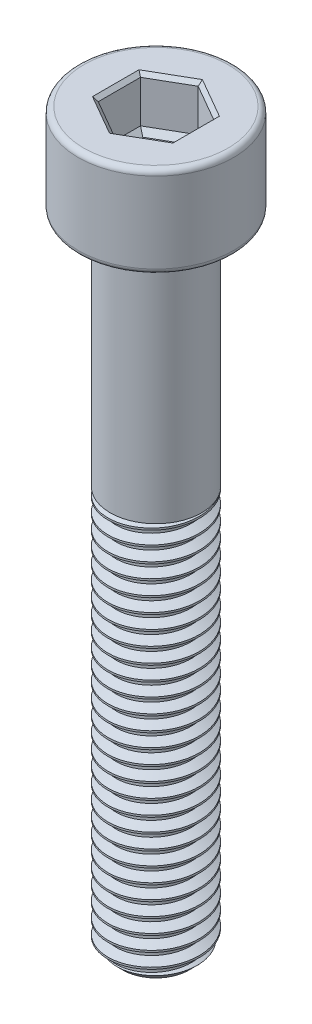
from build123d import *

# Parameters (mm, degrees)
SKETCH1_R           = 2.5
BOSS_EXTRUDE1_DEPTH = 22
THREAD1_PITCH       = 0.8
SKETCH2_R           = 2.5
BOSS_EXTRUDE2_DEPTH = 13
SKETCH3_R           = 4.25
BOSS_EXTRUDE3_DEPTH = 5
FILLET1_R           = 0.3
CUT_EXTRUDE1_DEPTH  = 2.5
CHAMFER1_SIZE       = 0.2
CUT_EXTRUDE2_DEPTH  = 0.3
CUT_EXTRUDE2_DRAFT  = -45


with BuildPart() as part:
    # Sketch1 → Boss-Extrude1 (new body)
    with BuildSketch(Plane(origin=(0, 0, 0), x_dir=(1, 0, 0), z_dir=(0, 1, 0))):
        with Locations(Location((0, 0, 0), (0, 0, 270))):
            Circle(SKETCH1_R)
    extrude(amount=BOSS_EXTRUDE1_DEPTH)

    # Thread1: the profile of Thread Profile1 profile screwed along a right-hand helix of 28.75 turns, 8 arcs to a turn; built about Z, then put on its axis
    thread1_z = Axis((0, 0, 0), (0, 0, 1))
    thread1_corners = [(2.5003, 0, -0.000173205), (2.5003, 0, 0.700173203), (2.0669873, 0, 0.449999999), (2.0669873, 0, 0.249999999)]
    with BuildLine(mode=Mode.PRIVATE) as thread1_profile:
        Line(thread1_corners[0], thread1_corners[1])
        Line(thread1_corners[1], thread1_corners[2])
        Line(thread1_corners[2], thread1_corners[3])
        Line(thread1_corners[3], thread1_corners[0])
    thread1_cap = Face(thread1_profile.wire())
    thread1_turn_angles = [0, 22.5, 45, 67.5, 90, 112.5, 135, 157.5, 180, 202.5, 225, 247.5, 270, 292.5, 315, 337.5, 360]
    thread1_turn_weights = [1, 0.9238795325112867, 1, 0.9238795325112867, 1, 0.9238795325112867, 1, 0.9238795325112867, 1, 0.9238795325112867, 1, 0.9238795325112867, 1, 0.9238795325112867, 1, 0.9238795325112867, 1]
    thread1_turn_rails = [Edge.make_bspline([Vector(p[0], p[1], 0).rotate(thread1_z, thread1_turn_angles[k]) / thread1_turn_weights[k] + Vector(0, 0, p[2] + THREAD1_PITCH * thread1_turn_angles[k] / 360) for k in range(17)], [0, 0, 0, 1, 1, 2, 2, 3, 3, 4, 4, 5, 5, 6, 6, 7, 7, 8, 8, 8], 2, thread1_turn_weights) for p in thread1_corners]
    thread1_turn_sides = [Face.make_surface_from_curves(thread1_turn_rails[p[0]], thread1_turn_rails[p[1]]) for p in [(0, 1), (1, 2), (2, 3), (3, 0)]]
    thread1_last_angles = [10080, 10102.5, 10125, 10147.5, 10170, 10192.5, 10215, 10237.5, 10260, 10282.5, 10305, 10327.5, 10350]
    thread1_last_weights = [1, 0.9238795325112867, 1, 0.9238795325112867, 1, 0.9238795325112867, 1, 0.9238795325112867, 1, 0.9238795325112867, 1, 0.9238795325112867, 1]
    thread1_last_rails = [Edge.make_bspline([Vector(p[0], p[1], 0).rotate(thread1_z, thread1_last_angles[k]) / thread1_last_weights[k] + Vector(0, 0, p[2] + THREAD1_PITCH * thread1_last_angles[k] / 360) for k in range(13)], [0, 0, 0, 1, 1, 2, 2, 3, 3, 4, 4, 5, 5, 6, 6, 6], 2, thread1_last_weights) for p in thread1_corners]
    thread1_last_sides = [Face.make_surface_from_curves(thread1_last_rails[p[0]], thread1_last_rails[p[1]]) for p in [(0, 1), (1, 2), (2, 3), (3, 0)]]
    thread1 = Plane(origin=(0, 23, 0), x_dir=(-1, 0, 0), z_dir=(0, -1, 0)) * Solid(Shell([*[p.moved(Location((0, 0, THREAD1_PITCH * i))) for i in range(28) for p in thread1_turn_sides], *thread1_last_sides, thread1_cap, thread1_cap.rotate(thread1_z, 10350).moved(Location((0, 0, THREAD1_PITCH * 10350 / 360)))]))
    add(thread1, mode=Mode.SUBTRACT)

    # Sketch2 → Boss-Extrude2 (add)
    with BuildSketch(Plane(origin=(0, 22, 0), x_dir=(1, 0, 0), z_dir=(0, 1, 0))):
        with Locations(Location((0, 0, 0), (0, 0, 90))):
            Circle(SKETCH2_R)
    extrude(amount=BOSS_EXTRUDE2_DEPTH)

    # Sketch3 → Boss-Extrude3 (add)
    with BuildSketch(Plane(origin=(0, 35, 0), x_dir=(1, 0, 0), z_dir=(0, 1, 0))):
        with Locations(Location((0, 0, 0), (0, 0, 270))):
            Circle(SKETCH3_R)
    extrude(amount=BOSS_EXTRUDE3_DEPTH)

    # Fillet1
    fillet1_edges = [part.edges().sort_by_distance(p)[0] for p in [
        (0, 35, -4.25),
        (0, 40, -4.25),
    ]]
    fillet(fillet1_edges, radius=FILLET1_R)

    # Sketch4 → Cut-Revolve1 (revolve, cut)
    with BuildSketch(Plane.XY, mode=Mode.PRIVATE) as cut_revolve1_sk:
        Polygon((2.51, 0), (2.51, 0.7), (1.81, 0), align=None)
    revolve(cut_revolve1_sk.sketch.rotate(Axis((0, 0, 0), (0, 1, 0)), 90), axis=Axis((0, 0, 0), (0, 1, 0)), mode=Mode.SUBTRACT)

    # Sketch5 → Cut-Extrude1 (cut)
    with BuildSketch(Plane(origin=(0, 40, 0), x_dir=(1, 0, 0), z_dir=(0, 1, 0))):
        Polygon((0, 2.309401077), (-2, 1.154700538), (-2, -1.154700538), (0, -2.309401077), (2, -1.154700538), (2, 1.154700538), align=None)
    extrude(amount=-CUT_EXTRUDE1_DEPTH, mode=Mode.SUBTRACT)

    # Chamfer1
    chamfer1_edges = [part.edges().sort_by_distance(p)[0] for p in [
        (1, 40, -1.732050808),
        (-1, 40, -1.732050808),
        (-2, 40, 0),
        (-1, 40, 1.732050808),
        (1, 40, 1.732050808),
        (2, 40, 0),
    ]]
    chamfer(chamfer1_edges, length=CHAMFER1_SIZE)


with BuildPart() as cut_extrude2_tool:
    # Sketch6 → Cut-Extrude2 (with draft: the straight prism first)
    with BuildSketch(Plane(origin=(0, 37.5, 0), x_dir=(1, 0, 0), z_dir=(0, 1, 0))):
        Polygon((0, 2.309401077), (-2, 1.154700538), (-2, -1.154700538), (0, -2.309401077), (2, -1.154700538), (2, 1.154700538), align=None)
    extrude(amount=-CUT_EXTRUDE2_DEPTH)
    # Cut-Extrude2: the draft: its side faces are tilted about the plane it starts from
    cut_extrude2_sides = [cut_extrude2_tool.faces().sort_by_distance(p)[0] for p in [
        (-1, 37.35, -1.732050808),
        (-2, 37.35, 0),
        (-1, 37.35, 1.732050808),
        (1, 37.35, 1.732050808),
        (2, 37.35, 0),
        (1, 37.35, -1.732050808),
    ]]
    draft(cut_extrude2_sides, Plane(origin=(0, 37.5, 0), x_dir=(1, 0, 0), z_dir=(0, 1, 0)), CUT_EXTRUDE2_DRAFT)


with BuildPart() as part_1:
    add(part.part)

    # Cut-Extrude2: cut by cut_extrude2_tool
    add(cut_extrude2_tool.part, mode=Mode.SUBTRACT)


solid = part_1.part
